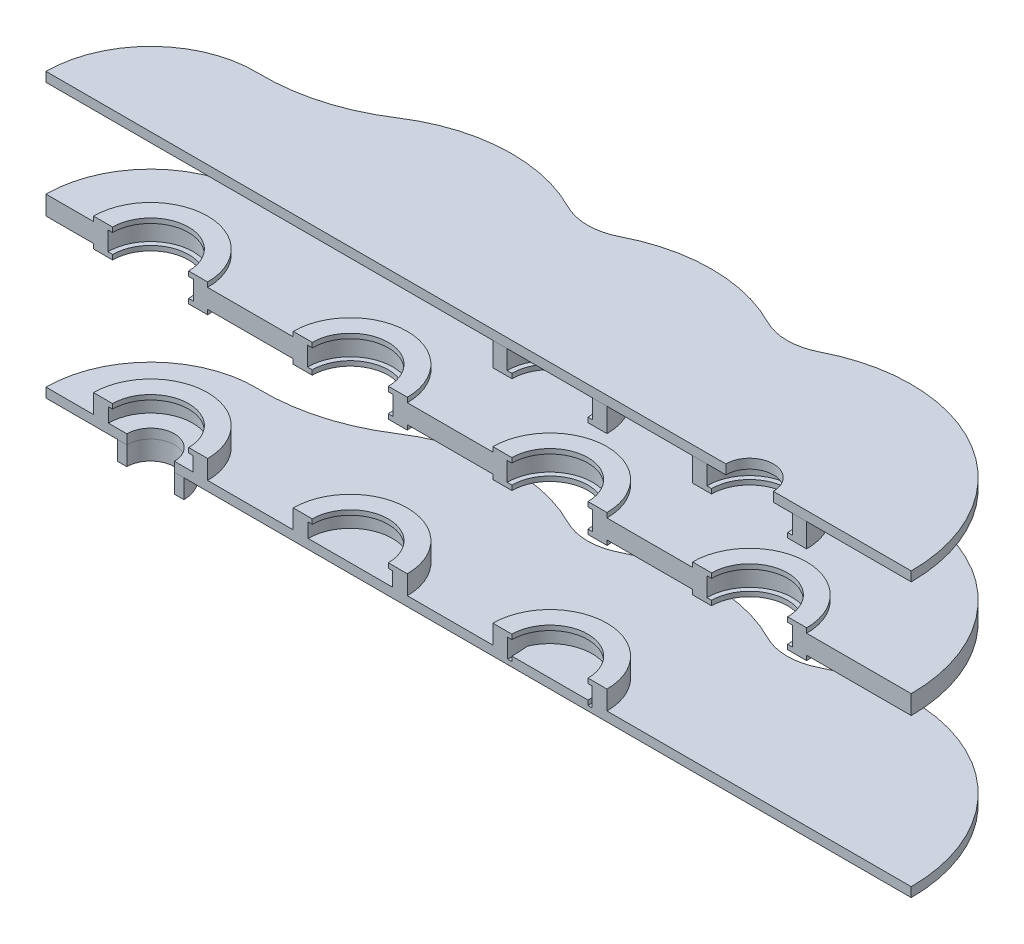
from build123d import *

# Parameters (mm, degrees)
SKETCH1_R               = 31.75
BOSS_EXTRUDE1_DEPTH     = 6.35
SKETCH1_5_R             = 76.2
SKETCH1_5_R_2           = 56.3499
BOSS_EXTRUDE2_DEPTH     = 31.75
CUT_EXTRUDE1_DEPTH      = 331.216
CUT_EXTRUDE1_DEPTH_BACK = 329.946
SKETCH3_W               = 1329.198210048
SKETCH3_H               = 309.557135386
BOSS_EXTRUDE7_DEPTH     = 6.35
LPATTERN4_COUNT         = 4
LPATTERN4_PITCH         = 266.7
BOSS_EXTRUDE9_START     = -210.566
BOSS_EXTRUDE9_DEPTH     = 25.4
LPATTERN6_COUNT         = 4
LPATTERN6_PITCH         = 266.7
BOSS_EXTRUDE10_START    = -12.7
BOSS_EXTRUDE10_DEPTH    = 12.7
BOSS_EXTRUDE11_DEPTH    = 25.4
BOSS_EXTRUDE13_DEPTH    = 6.35
BOSS_EXTRUDE14_START    = -31.75
BOSS_EXTRUDE14_DEPTH    = 6.35
LPATTERN7_COUNT         = 4
LPATTERN7_PITCH         = 266.7
SKETCH15_R              = 77.31521383
CUT_EXTRUDE4_DEPTH      = 25.4
BOSS_EXTRUDE16_START    = 97.536
BOSS_EXTRUDE16_DEPTH    = 25.4
BOSS_EXTRUDE16_2_DEPTH  = 25.4
BOSS_EXTRUDE17_START    = 91.186
BOSS_EXTRUDE17_DEPTH    = 6.35
BOSS_EXTRUDE18_START    = 122.936
BOSS_EXTRUDE18_DEPTH    = 12.7
CUT_EXTRUDE11_START     = -802.64
CUT_EXTRUDE11_DEPTH     = 802.64
BOSS_EXTRUDE27_DEPTH    = 25.4


# Read off the part's stored shape, not the designer's step: Boss-Extrude10
with BuildPart() as part:
    # Sketch1 → Boss-Extrude1 (new body)
    with BuildSketch(Plane(origin=(0, 0, 0), x_dir=(1, 0, 0), z_dir=(0, 1, 0))):
        with BuildLine():
            ThreePointArc((422.728571429, -85.252125475), (557.978233446, -137.520909104), (666.75, -41.639734629))
            ThreePointArc((666.75, -41.639734629), (912.645903808, -82.761763733), (800.1, 139.7))
            Line((800.1, 139.7), (533.4, 139.7))
            Line((533.4, 139.7), (293.135129627, 175.823843439))
            ThreePointArc((293.135129627, 175.823843439), (249.780889695, 176.99317418), (207.433333333, 167.631447593))
            Line((207.433333333, 167.631447593), (-29.633333333, 83.815723797))
            ThreePointArc((-29.633333333, 83.815723797), (-88.9, 0), (-29.633333333, -83.815723797))
            Line((-29.633333333, -83.815723797), (207.433333333, -167.631447593))
            ThreePointArc((207.433333333, -167.631447593), (330.23978857, -166.058830745), (422.728571429, -85.252125475))
        make_face()
        with Locations(Location((0, 0, 0), (0, 0, 270))):
            Circle(SKETCH1_R, mode=Mode.SUBTRACT)
    extrude(amount=BOSS_EXTRUDE1_DEPTH)

    # Sketch1<5> → Boss-Extrude2 (add)
    # profile 1 of 4: a face of its own
    with BuildSketch(Plane(origin=(0, 0, 0), x_dir=(1, 0, 0), z_dir=(0, 1, 0))):
        with Locations(Location((0, 0, 0), (0, 0, 270))):
            Circle(SKETCH1_5_R)
        with Locations(Location((0, 0, 0), (0, 0, 270))):
            Circle(SKETCH1_5_R_2, mode=Mode.SUBTRACT)
    # profile 2 of 4: a face of its own
    with BuildSketch(Plane(origin=(0, 0, 0), x_dir=(1, 0, 0), z_dir=(0, 1, 0))):
        with Locations(Location((266.7, 0, 0), (0, 0, 270))):
            Circle(SKETCH1_5_R)
        with Locations(Location((266.7, 0, 0), (0, 0, 270))):
            Circle(SKETCH1_5_R_2, mode=Mode.SUBTRACT)
    # profile 3 of 4: a face of its own
    with BuildSketch(Plane(origin=(0, 0, 0), x_dir=(1, 0, 0), z_dir=(0, 1, 0))):
        with Locations(Location((533.4, 0, 0), (0, 0, 270))):
            Circle(SKETCH1_5_R)
        with Locations(Location((533.4, 0, 0), (0, 0, 270))):
            Circle(SKETCH1_5_R_2, mode=Mode.SUBTRACT)
    # profile 4 of 4: a face of its own
    with BuildSketch(Plane(origin=(0, 0, 0), x_dir=(1, 0, 0), z_dir=(0, 1, 0))):
        with Locations(Location((800.1, 0, 0), (0, 0, 270))):
            Circle(SKETCH1_5_R)
        with Locations(Location((800.1, 0, 0), (0, 0, 270))):
            Circle(SKETCH1_5_R_2, mode=Mode.SUBTRACT)
    extrude(amount=BOSS_EXTRUDE2_DEPTH)

    # Sketch3 → Cut-Extrude1 (cut, two sides: drawn at the far end of the back side and taken through both)
    with BuildSketch(Plane(origin=(0, 6.35, 0), x_dir=(1, 0, 0), z_dir=(0, 1, 0)).offset(-CUT_EXTRUDE1_DEPTH_BACK)):
        with Locations((427.590126739, -154.778567693)):
            Rectangle(SKETCH3_W, SKETCH3_H)
    extrude(amount=CUT_EXTRUDE1_DEPTH + CUT_EXTRUDE1_DEPTH_BACK, mode=Mode.SUBTRACT)

    # Sketch5 → Boss-Extrude7 (add)
    with BuildSketch(Plane(origin=(0, 31.75, 0), x_dir=(1, 0, 0), z_dir=(0, 1, 0))):
        with BuildLine():
            ThreePointArc((56.3499, 0), (0, 56.3499), (-56.3499, 0))
            Line((-56.3499, 0), (-50.8, 0))
            ThreePointArc((-50.8, 0), (0, 50.8), (50.8, 0))
            Line((50.8, 0), (56.3499, 0))
        make_face()
        with BuildLine():
            Line((56.3499, 0), (76.2, 0))
            ThreePointArc((76.2, 0), (0, 76.2), (-76.2, 0))
            Line((-76.2, 0), (-56.3499, 0))
            ThreePointArc((-56.3499, 0), (0, 56.3499), (56.3499, 0))
        make_face()
    boss_extrude7 = extrude(amount=BOSS_EXTRUDE7_DEPTH)

    # LPattern4: Boss-Extrude7 ×4
    with Locations(*[(i * LPATTERN4_PITCH, 0, 0) for i in range(1, LPATTERN4_COUNT)]):
        add(boss_extrude7)

    # Boss-Extrude10 outline → Boss-Extrude10 (add)
    with BuildSketch(Plane.XZ.offset(BOSS_EXTRUDE10_START)):
        with BuildLine():
            ThreePointArc((-139.7, 0), (-112.009186485, -83.486718362), (-39.914285714, -133.876584196))
            Line((-39.914285714, -133.876584196), (205.014285714, -206.900175575))
            ThreePointArc((205.014285714, -206.900175575), (235.530607214, -213.638196382), (266.7, -215.9))
            Line((266.7, -215.9), (800.1, -215.9))
            ThreePointArc((800.1, -215.9), (952.764354058, -152.664354058), (1016, 0))
            Line((1016, 0), (876.3, 0))
            ThreePointArc((876.3, 0), (800.1, -76.2), (723.9, 0))
            Line((723.9, 0), (609.6, 0))
            ThreePointArc((609.6, 0), (533.4, -76.2), (457.2, 0))
            Line((457.2, 0), (342.9, 0))
            ThreePointArc((342.9, 0), (266.7, -76.2), (190.5, 0))
            Line((190.5, 0), (76.2, 0))
            ThreePointArc((76.2, 0), (0, -76.2), (-76.2, 0))
            Line((-76.2, 0), (-139.7, 0))
        make_face()
        with BuildLine():
            Line((-31.75, 0), (-56.3499, 0))
            ThreePointArc((-56.3499, 0), (0, -56.3499), (56.3499, 0))
            Line((56.3499, 0), (31.75, 0))
            ThreePointArc((31.75, 0), (0, -31.75), (-31.75, 0))
        make_face()
        with BuildLine():
            Line((323.0499, 0), (210.3501, 0))
            ThreePointArc((210.3501, 0), (266.7, -56.3499), (323.0499, 0))
        make_face()
        with BuildLine():
            Line((584.2, 0), (482.6, 0))
            ThreePointArc((482.6, 0), (482.321102562, -10.97042068), (481.485130802, -21.912498402))
            ThreePointArc((481.485130802, -21.912498402), (533.4, -56.3499), (585.314869198, -21.912498402))
            ThreePointArc((585.314869198, -21.912498402), (584.478897438, -10.97042068), (584.2, 0))
        make_face()
        with BuildLine():
            ThreePointArc((743.7501, 0), (800.1, -56.3499), (856.4499, 0))
            Line((856.4499, 0), (743.7501, 0))
        make_face()
    extrude(amount=BOSS_EXTRUDE10_DEPTH)

    # Sketch15 → Cut-Extrude4 (cut)
    with BuildSketch(Plane(origin=(0, 38.1, 0), x_dir=(1, 0, 0), z_dir=(0, 1, 0))):
        with Locations((800.1, 0)):
            Circle(SKETCH15_R)
    extrude(amount=-CUT_EXTRUDE4_DEPTH, mode=Mode.SUBTRACT)


with BuildPart() as body_2:
    # Sketch8 → Boss-Extrude9 (new body)
    with BuildSketch(Plane.XZ.offset(BOSS_EXTRUDE9_START)):
        with BuildLine():
            Line((76.2, 0), (57.15, 0))
            ThreePointArc((57.15, 0), (0, -57.15), (-57.15, 0))
            Line((-57.15, 0), (-76.2, 0))
            ThreePointArc((-76.2, 0), (0, -76.2), (76.2, 0))
        make_face()
    boss_extrude9 = extrude(amount=-BOSS_EXTRUDE9_DEPTH)



with BuildPart() as lpattern6_1:
    # LPattern6: pattern copy
    add(boss_extrude9.moved(Location(Vector(1, 0, 0) * (1 * LPATTERN6_PITCH))))


with BuildPart() as lpattern6_2:
    # LPattern6: pattern copy
    add(boss_extrude9.moved(Location(Vector(1, 0, 0) * (2 * LPATTERN6_PITCH))))


with BuildPart() as lpattern6_3:
    # LPattern6: pattern copy
    add(boss_extrude9.moved(Location(Vector(1, 0, 0) * (3 * LPATTERN6_PITCH))))


with BuildPart() as body_2_1:
    add(body_2.part)

    add(lpattern6_1.part)  # Boss-Extrude11 merges LPattern6_1

    add(lpattern6_2.part)  # Boss-Extrude11 merges LPattern6_2

    add(lpattern6_3.part)  # Boss-Extrude11 merges LPattern6_3
    # Sketch11 → Boss-Extrude11 (add)
    with BuildSketch(Plane(origin=(0, 235.966, 0), x_dir=(1, 0, 0), z_dir=(0, 1, 0))):
        with BuildLine():
            Line((76.2, 0), (190.5, 0))
            ThreePointArc((190.5, 0), (266.7, 76.2), (342.9, 0))
            Line((342.9, 0), (457.2, 0))
            ThreePointArc((457.2, 0), (533.4, 76.2), (609.6, 0))
            Line((609.6, 0), (723.9, 0))
            ThreePointArc((723.9, 0), (800.1, 76.2), (876.3, 0))
            Line((876.3, 0), (1016, 0))
            ThreePointArc((1016, 0), (952.764354058, 152.664354058), (800.1, 215.9))
            Line((800.1, 215.9), (266.7, 215.9))
            ThreePointArc((266.7, 215.9), (235.530607214, 213.638196382), (205.014285714, 206.900175575))
            Line((205.014285714, 206.900175575), (-39.914285714, 133.876584196))
            ThreePointArc((-39.914285714, 133.876584196), (-112.009186485, 83.486718362), (-139.7, 0))
            Line((-139.7, 0), (-76.2, 0))
            ThreePointArc((-76.2, 0), (0, 76.2), (76.2, 0))
        make_face()
    extrude(amount=-BOSS_EXTRUDE11_DEPTH)

    # Sketch13 → Boss-Extrude13 (add)
    with BuildSketch(Plane(origin=(0, 235.966, 0), x_dir=(1, 0, 0), z_dir=(0, 1, 0))):
        with BuildLine():
            ThreePointArc((57.15, 0), (0, 57.15), (-57.15, 0))
            Line((-57.15, 0), (-50.8, 0))
            ThreePointArc((-50.8, 0), (0, 50.8), (50.8, 0))
            Line((50.8, 0), (57.15, 0))
        make_face()
        with BuildLine():
            ThreePointArc((76.2, 0), (0, 76.2), (-76.2, 0))
            Line((-76.2, 0), (-57.15, 0))
            ThreePointArc((-57.15, 0), (0, 57.15), (57.15, 0))
            Line((57.15, 0), (76.2, 0))
        make_face()
    boss_extrude13 = extrude(amount=BOSS_EXTRUDE13_DEPTH)

    # Sketch13<4> → Boss-Extrude14 (add)
    with BuildSketch(Plane(origin=(0, 235.966, 0), x_dir=(1, 0, 0), z_dir=(0, 1, 0)).offset(BOSS_EXTRUDE14_START)):
        with BuildLine():
            ThreePointArc((76.2, 0), (0, 76.2), (-76.2, 0))
            Line((-76.2, 0), (-57.15, 0))
            ThreePointArc((-57.15, 0), (0, 57.15), (57.15, 0))
            Line((57.15, 0), (76.2, 0))
        make_face()
        with BuildLine():
            ThreePointArc((57.15, 0), (0, 57.15), (-57.15, 0))
            Line((-57.15, 0), (-50.8, 0))
            ThreePointArc((-50.8, 0), (0, 50.8), (50.8, 0))
            Line((50.8, 0), (57.15, 0))
        make_face()
    boss_extrude14 = extrude(amount=BOSS_EXTRUDE14_DEPTH)

    # LPattern7: Boss-Extrude13, Boss-Extrude14 ×4
    with Locations(*[(i * LPATTERN7_PITCH, 0, 0) for i in range(1, LPATTERN7_COUNT)]):
        add(boss_extrude13)
        add(boss_extrude14)


with BuildPart() as body_3:
    # Sketch17 → Boss-Extrude16 (new body)
    with BuildSketch(Plane(origin=(0, 242.316, 0), x_dir=(1, 0, 0), z_dir=(0, 1, 0)).offset(BOSS_EXTRUDE16_START)):
        with BuildLine():
            Line((590.55, 0), (609.6, 0))
            ThreePointArc((609.6, 0), (533.4, 76.2), (457.2, 0))
            Line((457.2, 0), (476.25, 0))
            ThreePointArc((476.25, 0), (533.4, 57.15), (590.55, 0))
        make_face()
    extrude(amount=BOSS_EXTRUDE16_DEPTH)



with BuildPart() as body_4:
    # Sketch17 → Boss-Extrude16 2 (new body)
    with BuildSketch(Plane(origin=(0, 242.316, 0), x_dir=(1, 0, 0), z_dir=(0, 1, 0)).offset(BOSS_EXTRUDE16_START)):
        with BuildLine():
            ThreePointArc((742.95, 0), (800.1, 57.15), (857.25, 0))
            Line((857.25, 0), (876.3, 0))
            ThreePointArc((876.3, 0), (800.1, 76.2), (723.9, 0))
            Line((723.9, 0), (742.95, 0))
        make_face()
    extrude(amount=BOSS_EXTRUDE16_2_DEPTH)


with BuildPart() as body_3_1:
    add(body_3.part)

    add(body_4.part)  # Boss-Extrude17 merges body 4
    # Sketch17<3> → Boss-Extrude17 (add)
    with BuildSketch(Plane(origin=(0, 242.316, 0), x_dir=(1, 0, 0), z_dir=(0, 1, 0)).offset(BOSS_EXTRUDE17_START)):
        with BuildLine():
            Line((590.55, 0), (609.6, 0))
            ThreePointArc((609.6, 0), (533.4, 76.2), (457.2, 0))
            Line((457.2, 0), (476.25, 0))
            ThreePointArc((476.25, 0), (533.4, 57.15), (590.55, 0))
        make_face()
        with BuildLine():
            Line((584.2, 0), (590.55, 0))
            ThreePointArc((590.55, 0), (533.4, 57.15), (476.25, 0))
            Line((476.25, 0), (482.6, 0))
            ThreePointArc((482.6, 0), (533.4, 50.8), (584.2, 0))
        make_face()
        with BuildLine():
            ThreePointArc((749.3, 0), (800.1, 50.8), (850.9, 0))
            Line((850.9, 0), (857.25, 0))
            ThreePointArc((857.25, 0), (800.1, 57.15), (742.95, 0))
            Line((742.95, 0), (749.3, 0))
        make_face()
        with BuildLine():
            ThreePointArc((742.95, 0), (800.1, 57.15), (857.25, 0))
            Line((857.25, 0), (876.3, 0))
            ThreePointArc((876.3, 0), (800.1, 76.2), (723.9, 0))
            Line((723.9, 0), (742.95, 0))
        make_face()
    extrude(amount=BOSS_EXTRUDE17_DEPTH)


with BuildPart() as body_4_2:
    # Sketch17<4> → Boss-Extrude18 (new body)
    with BuildSketch(Plane(origin=(0, 242.316, 0), x_dir=(1, 0, 0), z_dir=(0, 1, 0)).offset(BOSS_EXTRUDE18_START)):
        with BuildLine():
            ThreePointArc((768.35, 0), (800.1, 31.75), (831.85, 0))
            Line((831.85, 0), (1016, 0))
            ThreePointArc((1016, 0), (952.764354058, 152.664354058), (800.1, 215.9))
            Line((800.1, 215.9), (266.7, 215.9))
            ThreePointArc((266.7, 215.9), (235.530607214, 213.638196382), (205.014285714, 206.900175575))
            Line((205.014285714, 206.900175575), (-39.914285714, 133.876584196))
            ThreePointArc((-39.914285714, 133.876584196), (-112.009186485, 83.486718362), (-139.7, 0))
            Line((-139.7, 0), (768.35, 0))
        make_face()
    extrude(amount=BOSS_EXTRUDE18_DEPTH)


with BuildPart() as cut_extrude11_tool:
    # Sketch19 → Cut-Extrude11 (new body)
    with BuildSketch(Plane.XZ.offset(CUT_EXTRUDE11_START)):
        with BuildLine():
            ThreePointArc((205.014285714, -206.900175575), (175.939742435, -195.896364557), (148.746911197, -180.831078197))
            ThreePointArc((148.746911197, -180.831078197), (79.272933335, -149.208445007), (3.54078341, -139.655121112))
            ThreePointArc((3.54078341, -139.655121112), (-18.414825269, -138.480988624), (-39.914285714, -133.876584196))
            Line((-39.914285714, -133.876584196), (205.014285714, -206.900175575))
        make_face()
        with BuildLine():
            ThreePointArc((533.4, -215.9), (482.70078121, -209.86281046), (434.836956522, -192.088876462))
            ThreePointArc((434.836956522, -192.088876462), (400.05, -183.684950507), (365.263043478, -192.088876462))
            ThreePointArc((365.263043478, -192.088876462), (317.39921879, -209.86281046), (266.7, -215.9))
            Line((266.7, -215.9), (533.4, -215.9))
        make_face()
        with BuildLine():
            Line((533.4, -215.9), (800.1, -215.9))
            ThreePointArc((800.1, -215.9), (749.40078121, -209.86281046), (701.536956522, -192.088876462))
            ThreePointArc((701.536956522, -192.088876462), (666.75, -183.684950507), (631.963043478, -192.088876462))
            ThreePointArc((631.963043478, -192.088876462), (584.09921879, -209.86281046), (533.4, -215.9))
        make_face()
    extrude(amount=CUT_EXTRUDE11_DEPTH)


with BuildPart() as part_1:
    add(part.part)

    # Cut-Extrude11: cut by cut_extrude11_tool
    add(cut_extrude11_tool.part, mode=Mode.SUBTRACT)


with BuildPart() as body_2_2:
    add(body_2_1.part)

    # Cut-Extrude11: cut by cut_extrude11_tool
    add(cut_extrude11_tool.part, mode=Mode.SUBTRACT)


with BuildPart() as body_4_2_1:
    add(body_4_2.part)

    # Cut-Extrude11: cut by cut_extrude11_tool
    add(cut_extrude11_tool.part, mode=Mode.SUBTRACT)


with BuildPart() as body_5:
    # Sketch23 → Boss-Extrude27 (new body)
    with BuildSketch(Plane.XZ):
        with BuildLine():
            Line((-44.45, 0), (-31.75, 0))
            ThreePointArc((-31.75, 0), (0, -31.75), (31.75, 0))
            Line((31.75, 0), (44.45, 0))
            ThreePointArc((44.45, 0), (0, -44.45), (-44.45, 0))
        make_face()
    extrude(amount=BOSS_EXTRUDE27_DEPTH)


solid = Compound([body_3_1.part, part_1.part, body_2_2.part, body_4_2_1.part, body_5.part])
